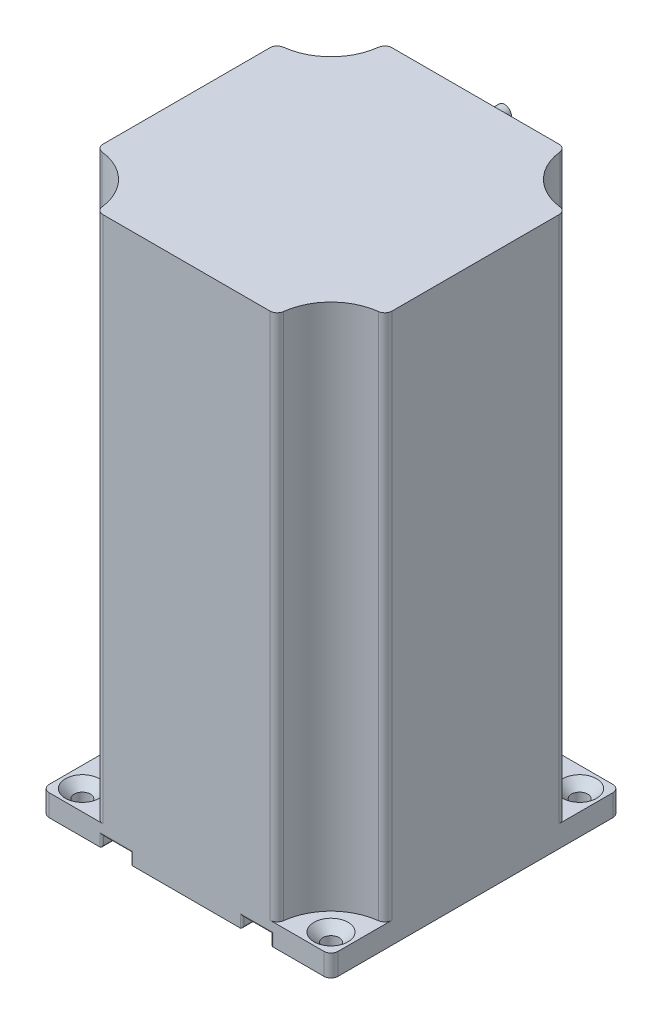
from build123d import *

# Parameters (mm, degrees)
SZKIC1_W                    = 80
SZKIC1_H                    = 80
DODANIE_WYCI_GNI_CIE1_DEPTH = 12
SZKIC2_R                    = 15
WYTNIJ_WYCI_GNI_CIE1_DEPTH  = 6
LUSTRO2_COPY_1_SKETCH_R     = 15
LUSTRO2_COPY_1_DEPTH        = 6
ZAOKR_GLENIE1_R             = 2
SZKIC8_R                    = 2
WYTNIJ_WYCI_GNI_CIE2_DEPTH  = 58.827329179
WYTNIJ_WYCI_GNI_CIE3_DEPTH  = 3
ZAOKR_GLENIE2_R             = 0.5
SZKIC10_R                   = 32.5
DODANIE_WYCI_GNI_CIE2_DEPTH = 0.5
ZAOKR_GLENIE3_R             = 0.5
SZKIC11_R                   = 7
WYTNIJ_WYCI_GNI_CIE4_DEPTH  = 58.933151131
SFAZOWANIE1_SIZE            = 0.5
DODANIE_WYCI_GNI_CIE3_START = 128
SZKIC12_R                   = 7
SZKIC12_R_2                 = 2
DODANIE_WYCI_GNI_CIE3_DEPTH = 128
DODANIE_WYCI_GNI_CIE4_START = 12
DODANIE_WYCI_GNI_CIE4_DEPTH = 12
SZKIC16_W                   = 12
SZKIC16_H                   = 8
DODANIE_WYCI_GNI_CIE5_DEPTH = 3
SZKIC17_R                   = 2
DODANIE_WYCI_GNI_CIE6_DEPTH = 5


with BuildPart() as part:
    # Szkic1 → Dodanie-wyciągnięcie1 (new body)
    with BuildSketch(Plane(origin=(0, 0, 0), x_dir=(1, 0, 0), z_dir=(0, 1, 0))):
        Rectangle(SZKIC1_W, SZKIC1_H)
    extrude(amount=DODANIE_WYCI_GNI_CIE1_DEPTH)

    # Szkic2 → Wytnij-wyciągnięcie1 (cut)
    with BuildSketch(Plane(origin=(0, 12, 0), x_dir=(1, 0, 0), z_dir=(0, 1, 0))):
        with Locations((-40, -40)):
            Circle(SZKIC2_R)
    wytnij_wyci_gni_cie1 = extrude(amount=-WYTNIJ_WYCI_GNI_CIE1_DEPTH, mode=Mode.SUBTRACT)

    # Lustro1: Wytnij-wyciągnięcie1 across plane
    add(wytnij_wyci_gni_cie1.mirror(Plane(origin=(0, 0, 0), x_dir=(0, 0, 1), z_dir=(1, 0, 0))), mode=Mode.SUBTRACT)

    # Lustro2: Wytnij-wyciągnięcie1 across plane
    add(wytnij_wyci_gni_cie1.mirror(Plane.XY), mode=Mode.SUBTRACT)

    # Lustro2 copy 1 sketch → Lustro2 copy 1 (cut)
    with BuildSketch(Plane(origin=(0, 12, 0), x_dir=(-1, 0, 0), z_dir=(0, 1, 0))):
        with Locations((-40, -40)):
            Circle(LUSTRO2_COPY_1_SKETCH_R)
    extrude(amount=-LUSTRO2_COPY_1_DEPTH, mode=Mode.SUBTRACT)

    # Zaokrąglenie1
    zaokr_glenie1_edges = [part.edges().sort_by_distance(p)[0] for p in [
        (-40, 3, 40),
        (-40, 9, 25),
        (-25, 9, 40),
        (40, 3, 40),
        (25, 9, 40),
        (40, 9, 25),
        (40, 3, -40),
        (40, 9, -25),
        (25, 9, -40),
        (-40, 3, -40),
        (-40, 9, -25),
        (-25, 9, -40),
    ]]
    fillet(zaokr_glenie1_edges, radius=ZAOKR_GLENIE1_R)

    # Szkic5 → Pogłębienie stożkowe pod M4 Wkręt z łbem płaskim1 (revolve, cut)
    with BuildSketch(Plane(origin=(-34.403805922, 6, -34.403805922), x_dir=(0, 0, 1), z_dir=(1, 0, 0))):
        Polygon((0, 0), (0, 17.031936393), (2.25, 15.68), (2.25, 2.45), (4.7, 0), align=None)
    pog_bienie_sto_kowe_pod_m4_wkr_t_z_bem = revolve(axis=Axis((-34.403805922, 12.35, -34.403805922), (0, -1, 0)), mode=Mode.SUBTRACT)

    # Lustro3: Pogłębienie stożkowe pod M4 Wkręt z łbem płaskim1 across plane
    add(pog_bienie_sto_kowe_pod_m4_wkr_t_z_bem.mirror(Plane.XY), mode=Mode.SUBTRACT)

    # Lustro4: Pogłębienie stożkowe pod M4 Wkręt z łbem płaskim1 across plane
    add(pog_bienie_sto_kowe_pod_m4_wkr_t_z_bem.mirror(Plane(origin=(0, 0, 0), x_dir=(0, 0, 1), z_dir=(1, 0, 0))), mode=Mode.SUBTRACT)

    # Lustro4 copy 1 sketch → Lustro4 copy 1 (revolve, cut)
    with BuildSketch(Plane(origin=(34.403805922, 6, 34.403805922), x_dir=(0, 0, -1), z_dir=(-1, 0, 0))):
        Polygon((0, 0), (0, 17.031936393), (2.25, 15.68), (2.25, 2.45), (4.7, 0), align=None)
    revolve(axis=Axis((34.403805922, 12.35, 34.403805922), (0, -1, 0)), mode=Mode.SUBTRACT)

    # Szkic8 → Wytnij-wyciągnięcie2 (cut, through all)
    with BuildSketch(Plane(origin=(0, 12, 0), x_dir=(1, 0, 0), z_dir=(0, 1, 0))):
        with Locations(Location((-19.403805922, 34.403805922, 0), (0, 0, 270))):
            Circle(SZKIC8_R)
        with Locations(Location((-19.403805922, -34.403805922, 0), (0, 0, 90))):
            Circle(SZKIC8_R)
        with Locations(Location((19.403805922, 34.403805922, 0), (0, 0, 90))):
            Circle(SZKIC8_R)
        with Locations(Location((19.403805922, -34.403805922, 0), (0, 0, 270))):
            Circle(SZKIC8_R)
    extrude(amount=-WYTNIJ_WYCI_GNI_CIE2_DEPTH, mode=Mode.SUBTRACT)

    # Szkic9 → Wytnij-wyciągnięcie3 (cut)
    with BuildSketch(Plane.XZ):
        with BuildLine():
            Line((15.403805922, 34.403805922), (15.403805922, 40))
            Line((15.403805922, 40), (23.403805922, 40))
            Line((23.403805922, 40), (23.403805922, 34.403805922))
            ThreePointArc((23.403805922, 34.403805922), (19.403805922, 30.403805922), (15.403805922, 34.403805922))
        make_face()
        with BuildLine():
            Line((-23.403805922, 34.403805922), (-23.403805922, 40))
            Line((-23.403805922, 40), (-15.403805922, 40))
            Line((-15.403805922, 40), (-15.403805922, 34.403805922))
            ThreePointArc((-15.403805922, 34.403805922), (-19.403805922, 30.403805922), (-23.403805922, 34.403805922))
        make_face()
        with BuildLine():
            Line((23.403805922, -34.403805922), (23.403805922, -40))
            Line((23.403805922, -40), (15.403805922, -40))
            Line((15.403805922, -40), (15.403805922, -34.403805922))
            ThreePointArc((15.403805922, -34.403805922), (19.403805922, -30.403805922), (23.403805922, -34.403805922))
        make_face()
        with BuildLine():
            Line((-15.403805922, -34.403805922), (-15.403805922, -40))
            Line((-15.403805922, -40), (-23.403805922, -40))
            Line((-23.403805922, -40), (-23.403805922, -34.403805922))
            ThreePointArc((-23.403805922, -34.403805922), (-19.403805922, -30.403805922), (-15.403805922, -34.403805922))
        make_face()
    extrude(amount=-WYTNIJ_WYCI_GNI_CIE3_DEPTH, mode=Mode.SUBTRACT)

    # Zaokrąglenie2
    zaokr_glenie2_edges = [part.edges().sort_by_distance(p)[0] for p in [
        (-19.403805922, 0, 30.403805922),
        (-15.403805922, 0, 37.201902961),
        (-23.403805922, 0, 37.201902961),
        (-19.403805922, 3, 40),
        (-23.403805922, 1.5, 40),
        (-15.403805922, 1.5, 40),
        (19.403805922, 0, -30.403805922),
        (15.403805922, 0, -37.201902961),
        (23.403805922, 0, -37.201902961),
        (19.403805922, 3, -40),
        (23.403805922, 1.5, -40),
        (15.403805922, 1.5, -40),
        (-19.403805922, 0, -30.403805922),
        (-23.403805922, 0, -37.201902961),
        (-15.403805922, 0, -37.201902961),
        (-19.403805922, 3, -40),
        (-15.403805922, 1.5, -40),
        (-23.403805922, 1.5, -40),
        (19.403805922, 0, 30.403805922),
        (23.403805922, 0, 37.201902961),
        (15.403805922, 0, 37.201902961),
        (19.403805922, 3, 40),
        (15.403805922, 1.5, 40),
        (23.403805922, 1.5, 40),
    ]]
    fillet(zaokr_glenie2_edges, radius=ZAOKR_GLENIE2_R)

    # Szkic10 → Dodanie-wyciągnięcie2 (add)
    with BuildSketch(Plane.XZ):
        with Locations(Location((0, 0, 0), (0, 0, 90))):
            Circle(SZKIC10_R)
    extrude(amount=DODANIE_WYCI_GNI_CIE2_DEPTH)

    # Zaokrąglenie3
    zaokr_glenie3_edges = [part.edges().sort_by_distance(p)[0] for p in [
        (0, -0.5, -32.5),
    ]]
    fillet(zaokr_glenie3_edges, radius=ZAOKR_GLENIE3_R - 0.0001)  # a hair under: the kernel refuses the full size

    # Szkic11 → Wytnij-wyciągnięcie4 (cut, through all)
    with BuildSketch(Plane.XZ.offset(0.5)):
        with Locations(Location((0, 0, 0), (0, 0, 270))):
            Circle(SZKIC11_R)
    extrude(amount=-WYTNIJ_WYCI_GNI_CIE4_DEPTH, mode=Mode.SUBTRACT)

    # Sfazowanie1
    sfazowanie1_edges = [part.edges().sort_by_distance(p)[0] for p in [
        (0, -0.5, 7),
    ]]
    chamfer(sfazowanie1_edges, length=SFAZOWANIE1_SIZE)

    # Szkic12 → Dodanie-wyciągnięcie3 (add)
    with BuildSketch(Plane(origin=(0, 12, 0), x_dir=(1, 0, 0), z_dir=(0, 1, 0)).offset(DODANIE_WYCI_GNI_CIE3_START)):
        with BuildLine():
            Line((-40, 23.118056984), (-40, -23.118056984))
            ThreePointArc((-40, -23.118056984), (-39.495090003, -24.446479312), (-38.235294118, -25.104167927))
            ThreePointArc((-38.235294118, -25.104167927), (-29.393398282, -29.393398282), (-25.104167927, -38.235294118))
            ThreePointArc((-25.104167927, -38.235294118), (-24.446479312, -39.495090003), (-23.118056984, -40))
            Line((-23.118056984, -40), (23.118056984, -40))
            ThreePointArc((23.118056984, -40), (24.446479312, -39.495090003), (25.104167927, -38.235294118))
            ThreePointArc((25.104167927, -38.235294118), (29.393398282, -29.393398282), (38.235294118, -25.104167927))
            ThreePointArc((38.235294118, -25.104167927), (39.495090003, -24.446479312), (40, -23.118056984))
            Line((40, -23.118056984), (40, 23.118056984))
            ThreePointArc((40, 23.118056984), (39.495090003, 24.446479312), (38.235294118, 25.104167927))
            ThreePointArc((38.235294118, 25.104167927), (29.393398282, 29.393398282), (25.104167927, 38.235294118))
            ThreePointArc((25.104167927, 38.235294118), (24.446479312, 39.495090003), (23.118056984, 40))
            Line((23.118056984, 40), (-23.118056984, 40))
            ThreePointArc((-23.118056984, 40), (-24.446479312, 39.495090003), (-25.104167927, 38.235294118))
            ThreePointArc((-25.104167927, 38.235294118), (-29.393398282, 29.393398282), (-38.235294118, 25.104167927))
            ThreePointArc((-38.235294118, 25.104167927), (-39.495090003, 24.446479312), (-40, 23.118056984))
        make_face()
        with Locations(Location((0, 0, 0), (0, 0, 90))):
            Circle(SZKIC12_R, mode=Mode.SUBTRACT)
        with Locations(Location((-19.403805922, -34.403805922, 0), (0, 0, 270))):
            Circle(SZKIC12_R_2, mode=Mode.SUBTRACT)
        with Locations(Location((19.403805922, -34.403805922, 0), (0, 0, 270))):
            Circle(SZKIC12_R_2, mode=Mode.SUBTRACT)
        with Locations(Location((19.403805922, 34.403805922, 0), (0, 0, 270))):
            Circle(SZKIC12_R_2, mode=Mode.SUBTRACT)
        with Locations(Location((-19.403805922, 34.403805922, 0), (0, 0, 270))):
            Circle(SZKIC12_R_2, mode=Mode.SUBTRACT)
    extrude(amount=-DODANIE_WYCI_GNI_CIE3_DEPTH)

    # Szkic15 → Dodanie-wyciągnięcie4 (add)
    with BuildSketch(Plane(origin=(0, 140, 0), x_dir=(1, 0, 0), z_dir=(0, 1, 0)).offset(DODANIE_WYCI_GNI_CIE4_START)):
        with BuildLine():
            Line((-40, 23.118056984), (-40, -23.118056984))
            ThreePointArc((-40, -23.118056984), (-39.495090003, -24.446479312), (-38.235294118, -25.104167927))
            ThreePointArc((-38.235294118, -25.104167927), (-29.393398282, -29.393398282), (-25.104167927, -38.235294118))
            ThreePointArc((-25.104167927, -38.235294118), (-24.446479312, -39.495090003), (-23.118056984, -40))
            Line((-23.118056984, -40), (23.118056984, -40))
            ThreePointArc((23.118056984, -40), (24.446479312, -39.495090003), (25.104167927, -38.235294118))
            ThreePointArc((25.104167927, -38.235294118), (29.393398282, -29.393398282), (38.235294118, -25.104167927))
            ThreePointArc((38.235294118, -25.104167927), (39.495090003, -24.446479312), (40, -23.118056984))
            Line((40, -23.118056984), (40, 23.118056984))
            ThreePointArc((40, 23.118056984), (39.495090003, 24.446479312), (38.235294118, 25.104167927))
            ThreePointArc((38.235294118, 25.104167927), (29.393398282, 29.393398282), (25.104167927, 38.235294118))
            ThreePointArc((25.104167927, 38.235294118), (24.446479312, 39.495090003), (23.118056984, 40))
            Line((23.118056984, 40), (-23.118056984, 40))
            ThreePointArc((-23.118056984, 40), (-24.446479312, 39.495090003), (-25.104167927, 38.235294118))
            ThreePointArc((-25.104167927, 38.235294118), (-29.393398282, 29.393398282), (-38.235294118, 25.104167927))
            ThreePointArc((-38.235294118, 25.104167927), (-39.495090003, 24.446479312), (-40, 23.118056984))
        make_face()
    extrude(amount=-DODANIE_WYCI_GNI_CIE4_DEPTH)

    # Szkic16 → Dodanie-wyciągnięcie5 (add)
    with BuildSketch(Plane(origin=(0, 0, -40), x_dir=(-1, 0, 0), z_dir=(0, 0, -1))):
        with Locations((0, 144)):
            Rectangle(SZKIC16_W, SZKIC16_H)
    extrude(amount=DODANIE_WYCI_GNI_CIE5_DEPTH)

    # Szkic17 → Dodanie-wyciągnięcie6 (add)
    with BuildSketch(Plane(origin=(0, 0, -43), x_dir=(-1, 0, 0), z_dir=(0, 0, -1))):
        with Locations((0, 144)):
            Circle(SZKIC17_R)
    extrude(amount=DODANIE_WYCI_GNI_CIE6_DEPTH)


solid = part.part
